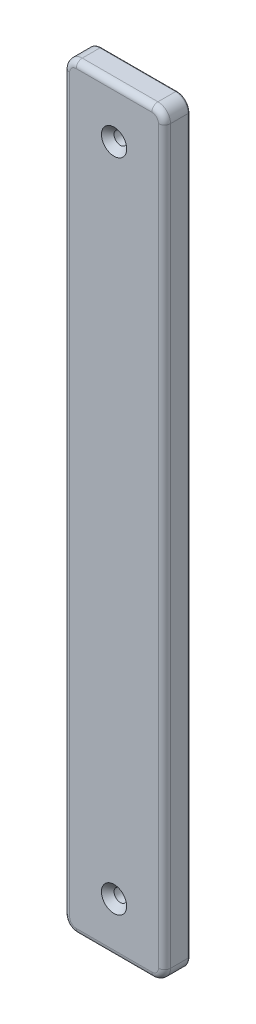
from build123d import *

# Parameters (mm, degrees)
SKETCH1_W          = 50.8
SKETCH1_H          = 381
BASE_EXTRUDE_DEPTH = 12.7
SKETCH2_R          = 3.175
CUT_EXTRUDE1_DEPTH = 193.605036279
CHAMFER1_SIZE      = 3.175
FILLET1_R          = 6.35
FILLET2_R          = 3.048
SHELL1_T           = -1.524
RIB1_REACH         = 194.511
SKETCH3_WALLS_W    = 1.524
SKETCH3_WALLS_H    = 717.22110579
RIB1_DRAFT_ANGLE   = 3
FILLET3_R          = 0.80298
FILLET4_R          = 0.762
FILLET5_R          = 2.54


with BuildPart() as part:
    # Sketch1 → Base-Extrude (new body)
    with BuildSketch(Plane.XY):
        Rectangle(SKETCH1_W, SKETCH1_H)
    extrude(amount=BASE_EXTRUDE_DEPTH)

    # Sketch2 → Cut-Extrude1 (cut, through all)
    with BuildSketch(Plane.XY.offset(12.7)):
        with Locations((0, -165.1)):
            Circle(SKETCH2_R)
        with Locations((0, 165.1)):
            Circle(SKETCH2_R)
    extrude(amount=-CUT_EXTRUDE1_DEPTH, mode=Mode.SUBTRACT)

    # Chamfer1
    chamfer1_edges = [part.edges().sort_by_distance(p)[0] for p in [
        (-3.175, -165.1, 12.7),
        (-3.175, 165.1, 12.7),
    ]]
    chamfer(chamfer1_edges, length=CHAMFER1_SIZE)

    # Fillet1
    fillet1_edges = [part.edges().sort_by_distance(p)[0] for p in [
        (25.4, -190.5, 6.35),
        (-25.4, -190.5, 6.35),
        (-25.4, 190.5, 6.35),
        (25.4, 190.5, 6.35),
    ]]
    fillet(fillet1_edges, radius=FILLET1_R)

    # Fillet2
    fillet2_edges = [part.edges().sort_by_distance(p)[0] for p in [
        (25.4, 0, 12.7),
        (0, -190.5, 12.7),
        (0, 190.5, 12.7),
        (-25.4, 0, 12.7),
        (23.540128061, 188.640128061, 12.7),
        (-23.540128061, 188.640128061, 12.7),
        (-23.540128061, -188.640128061, 12.7),
        (23.540128061, -188.640128061, 12.7),
    ]]
    fillet(fillet2_edges, radius=FILLET2_R)

    # Shell1
    shell1_openings = [part.faces().sort_by_distance(p)[0] for p in [
        (0, 0, 0),
    ]]
    offset(amount=SHELL1_T, openings=shell1_openings, kind=Kind.INTERSECTION)

    # Sketch3 walls → Rib1 (add, up to next)
    with BuildSketch(Plane(origin=(0, 0, 1.524), x_dir=(-1, 0, 0), z_dir=(0, 0, -1)), mode=Mode.PRIVATE) as rib1_sk1:
        Rectangle(SKETCH3_WALLS_W, SKETCH3_WALLS_H)
    rib1_tool1 = extrude(rib1_sk1.sketch, amount=-RIB1_REACH, mode=Mode.PRIVATE) - part.part
    add(rib1_tool1.solids().sort_by_distance((0, 0, 1.524))[0])

    # Rib1 draft
    rib1_draft_faces = [part.faces().sort_by_distance(p)[0] for p in [
        (0.762, 0, 1.905),
        (-0.762, 0, 1.905),
    ]]
    draft(rib1_draft_faces, Plane(origin=(0, 0, 1.524), x_dir=(-1, 0, 0), z_dir=(0, 0, -1)), RIB1_DRAFT_ANGLE)

    # Fillet3
    fillet3_edges = [part.edges().sort_by_distance(p)[0] for p in [
        (0.762, 0, 1.524),
        (-0.762, 0, 1.524),
    ]]
    fillet(fillet3_edges, radius=FILLET3_R - 0.0001)  # a hair under: the kernel refuses the full size

    # Fillet4
    fillet4_edges = [part.edges().sort_by_distance(p)[0] for p in [
        (25.4, 0, 0),
        (0, -190.5, 0),
        (-25.4, 0, 0),
        (0, 190.5, 0),
        (23.540128061, 188.640128061, 0),
        (-23.540128061, 188.640128061, 0),
        (-23.540128061, -188.640128061, 0),
        (23.540128061, -188.640128061, 0),
        (23.876, 0, 0),
        (-23.876, 0, 0),
        (0, -188.976, 0),
        (0, 188.976, 0),
    ]]
    fillet(fillet4_edges, radius=FILLET4_R - 0.0001)  # a hair under: the kernel refuses the full size

    # Fillet5
    fillet5_edges = [part.edges().sort_by_distance(p)[0] for p in [
        (-2.888343865, -168.80649035, 8.893738531),
        (-2.888343865, 168.80649035, 8.893738531),
    ]]
    fillet(fillet5_edges, radius=FILLET5_R)


solid = part.part
